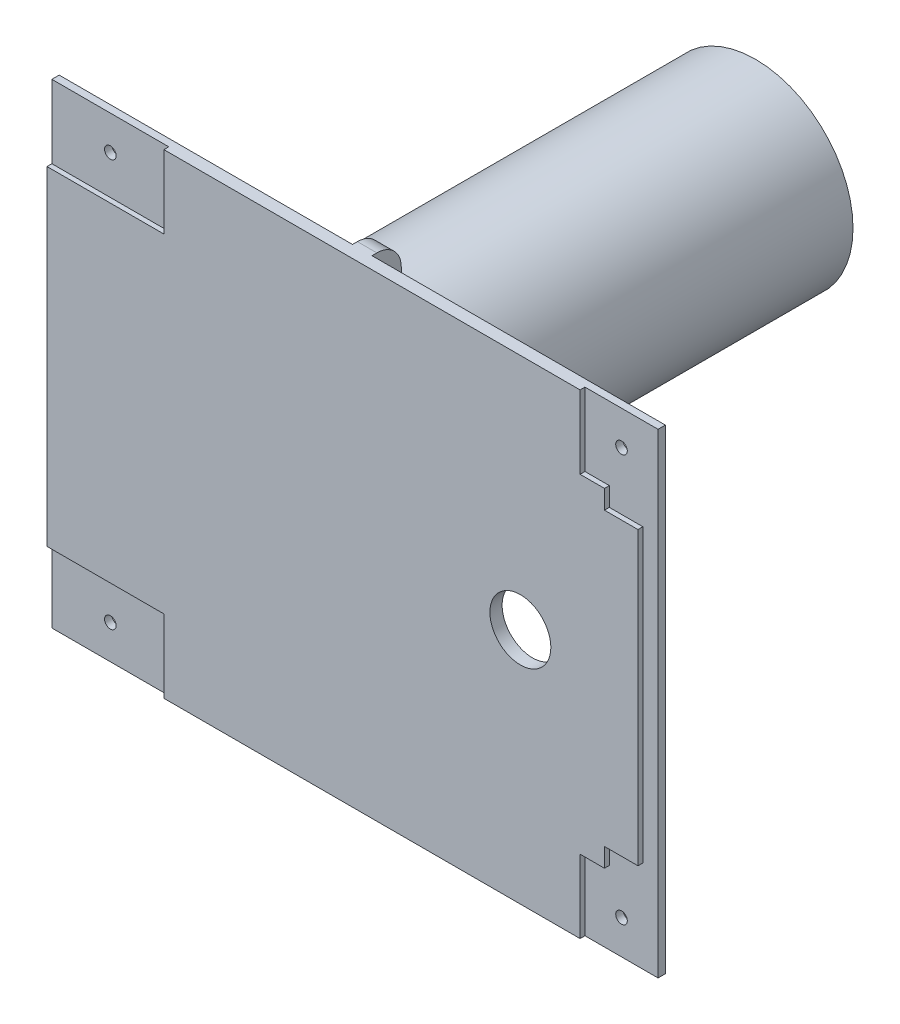
from build123d import *

# Parameters (mm, degrees)
CROQUIS1_W                 = 248.76
CROQUIS1_H                 = 195
SALIENTE_EXTRUIR1_DEPTH    = 5
CROQUIS2_W                 = 48
CROQUIS2_H                 = 30
CROQUIS2_W_2               = 30
CORTAR_EXTRUIR1_DEPTH      = 2
CROQUIS3_R                 = 2.375
CORTAR_EXTRUIR2_DEPTH      = 10
CROQUIS4_R                 = 40
SALIENTE_EXTRUIR2_DEPTH    = 206
CROQUIS5_R                 = 12.5
CORTAR_EXTRUIR3_DEPTH      = 10
CROQUIS12_W                = 12
CROQUIS12_H                = 30
SALIENTE_EXTRUIR3_DEPTH    = 4
REDONDEO1_R                = 10
REDONDEO2_R                = 10
REDONDEO3_R                = 10
CORTAR_EXTRUIR5_DEPTH      = 262.677217236
CORTAR_EXTRUIR5_DEPTH_BACK = 262.677217236
CROQUIS13_R                = 1.625
CORTAR_EXTRUIR7_DEPTH      = 2


with BuildPart() as part:
    # Croquis1 → Saliente-Extruir1 (new body)
    with BuildSketch(Plane.XY):
        with Locations((7.088293187, 0.26268)):
            Rectangle(CROQUIS1_W, CROQUIS1_H)
    extrude(amount=SALIENTE_EXTRUIR1_DEPTH)

    # Croquis2 → Cortar-Extruir1 (cut)
    with BuildSketch(Plane.XY.offset(5)):
        with Locations((-93.291706813, -82.23732)):
            Rectangle(CROQUIS2_W, CROQUIS2_H)
        with Locations((116.468293187, 82.76268)):
            Rectangle(CROQUIS2_W_2, CROQUIS2_H)
        with Locations((116.468293187, -82.23732)):
            Rectangle(CROQUIS2_W_2, CROQUIS2_H)
        with Locations((-93.291706813, 82.76268)):
            Rectangle(CROQUIS2_W, CROQUIS2_H)
    extrude(amount=-CORTAR_EXTRUIR1_DEPTH, mode=Mode.SUBTRACT)

    # Croquis3 → Cortar-Extruir2 (cut)
    with BuildSketch(Plane.XY.offset(5)):
        with Locations((-93.291706813, 83.76268)):
            Circle(CROQUIS3_R)
        with Locations((-93.291706813, -83.23732)):
            Circle(CROQUIS3_R)
        with Locations((116.468293187, 83.76268)):
            Circle(CROQUIS3_R)
        with Locations((116.468293187, -83.23732)):
            Circle(CROQUIS3_R)
    extrude(amount=-CORTAR_EXTRUIR2_DEPTH, mode=Mode.SUBTRACT)

    # Croquis4 → Saliente-Extruir2 (add)
    with BuildSketch(Plane(origin=(0, 0, 0), x_dir=(-1, 0, 0), z_dir=(0, 0, -1))):
        with Locations((37.531706813, 0.26268)):
            Circle(CROQUIS4_R)
    extrude(amount=SALIENTE_EXTRUIR2_DEPTH)

    # Croquis5 → Cortar-Extruir3 (cut)
    with BuildSketch(Plane(origin=(0, 0, 0), x_dir=(-1, 0, 0), z_dir=(0, 0, -1))):
        with Locations((-76.968293187, 0.26268)):
            Circle(CROQUIS5_R)
    extrude(amount=-CORTAR_EXTRUIR3_DEPTH, mode=Mode.SUBTRACT)

    # Croquis12 → Saliente-Extruir3 (add, symmetric)
    with BuildSketch(Plane(origin=(7.088293187, 0, 0), x_dir=(0, 0, -1), z_dir=(1, 0, 0))):
        with Locations((6, 82.76268)):
            Rectangle(CROQUIS12_W, CROQUIS12_H)
        with Locations((6, -82.23732)):
            Rectangle(CROQUIS12_W, CROQUIS12_H)
    extrude(amount=SALIENTE_EXTRUIR3_DEPTH, both=True)

    # Redondeo1
    redondeo1_edges = [part.edges().sort_by_distance(p)[0] for p in [
        (7.088293187, -67.23732, 0),
        (7.088293187, 67.76268, 0),
    ]]
    fillet(redondeo1_edges, radius=REDONDEO1_R)

    # Redondeo2
    redondeo2_edges = [part.edges().sort_by_distance(p)[0] for p in [
        (7.088293187, 67.76268, -12),
        (7.088293187, -67.23732, -12),
    ]]
    fillet(redondeo2_edges, radius=REDONDEO2_R)

    # Redondeo3
    redondeo3_edges = [part.edges().sort_by_distance(p)[0] for p in [
        (7.088293187, -97.23732, -12),
        (7.088293187, 97.76268, -12),
    ]]
    fillet(redondeo3_edges, radius=REDONDEO3_R)

    # Croquis13 → Cortar-Extruir5 (cut, two sides: drawn at the far end of the back side and taken through both)
    with BuildSketch(Plane(origin=(11.088293187, 0, 0), x_dir=(0, 0, -1), z_dir=(1, 0, 0)).offset(-CORTAR_EXTRUIR5_DEPTH_BACK)):
        with Locations((6, 87.76268)):
            Circle(CROQUIS13_R)
        with Locations((6, 77.76268)):
            Circle(CROQUIS13_R)
        with Locations((6, -77.23732)):
            Circle(CROQUIS13_R)
        with Locations((6, -87.23732)):
            Circle(CROQUIS13_R)
    extrude(amount=CORTAR_EXTRUIR5_DEPTH + CORTAR_EXTRUIR5_DEPTH_BACK, mode=Mode.SUBTRACT)

    # Croquis15 → Cortar-Extruir7 (cut)
    with BuildSketch(Plane.XY.offset(5)):
        Polygon((111.468293187, 67.76268), (131.468293187, 67.76268), (131.468293187, -67.23732), (111.468293187, -67.23732), (111.468293187, -59.48732), (125.218293187, -59.48732), (125.218293187, 60.01268), (111.468293187, 60.01268), align=None)
    extrude(amount=-CORTAR_EXTRUIR7_DEPTH, mode=Mode.SUBTRACT)


solid = part.part
